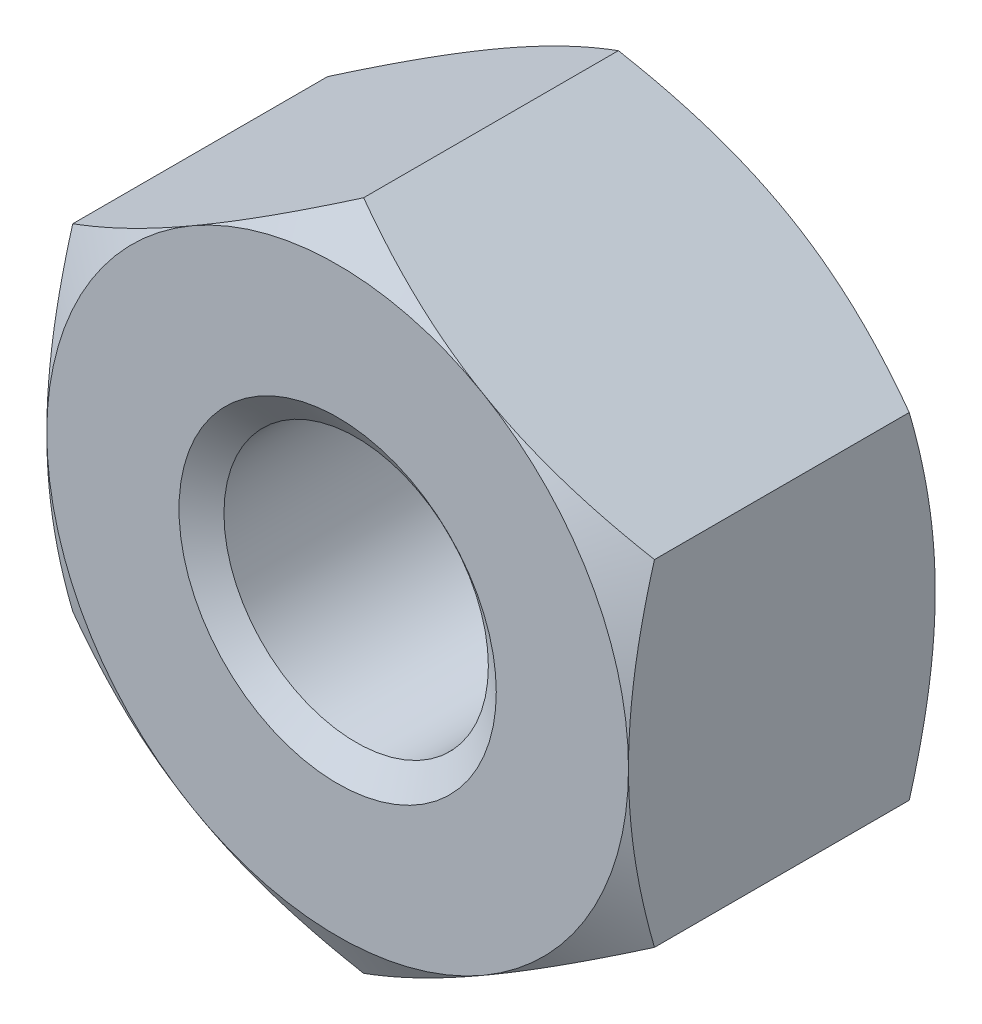
from build123d import *

# Parameters (mm, degrees)
BASENUT_START = -2.9
BASENUTSKE_R  = 1.25
BASENUT_DEPTH = 2.9


# Read off the part's stored shape, not the designer's step: ThreadSchematic
with BuildPart() as part:
    # BaseNutSke → BaseNut (new body)
    with BuildSketch(Plane.XY.offset(BASENUT_START)):
        Polygon((2.75, 1.58771324), (2.75, -1.58771324), (0, -3.175426481), (-2.75, -1.58771324), (-2.75, 1.58771324), (0, 3.175426481), align=None)
        Circle(BASENUTSKE_R, mode=Mode.SUBTRACT)
    extrude(amount=BASENUT_DEPTH)

    # Sketch5 (on Front Plane) → EndChamfer (revolve, cut)
    with BuildSketch(Plane.XY):
        Polygon((2.8746, 1.5), (2.682042927, 1.225), (2.9254, 1.225), (2.9254, 1.5), align=None)
    revolve(axis=Axis((2.9254, 1.225, 0), (-1, 0, 0)), mode=Mode.SUBTRACT)

    # Sketch3 → Double-Chamfer (revolve, cut)
    with BuildSketch(Plane(origin=(0, 0, 0), x_dir=(0, 0, -1), z_dir=(1, 0, 0))):
        Polygon((2.9, 2.75), (2.654379907, 3.175426481), (2.654379907, 13.175426481), (12.9, 13.175426481), (12.9, 2.75), align=None)
        Polygon((0.245620093, 13.175426481), (-10, 13.175426481), (-10, 2.75), (0, 2.75), (0.245620093, 3.175426481), align=None)
    revolve(axis=Axis((0, 0, 0), (0, 0, -1)), mode=Mode.SUBTRACT)

    # ThreadSchematic outline → ThreadSchematic (revolve, cut)
    with BuildSketch(Plane.XZ):
        Polygon((1.25, 0), (1.25, -0.175051885), (1.5, 0), align=None)
        Polygon((1.5, -2.8746), (1.25, -2.699548115), (1.25, -2.9), (1.5, -2.9), align=None)
    revolve(axis=Axis((0, 0, 0), (0, 0, 1)), mode=Mode.SUBTRACT)


solid = part.part
